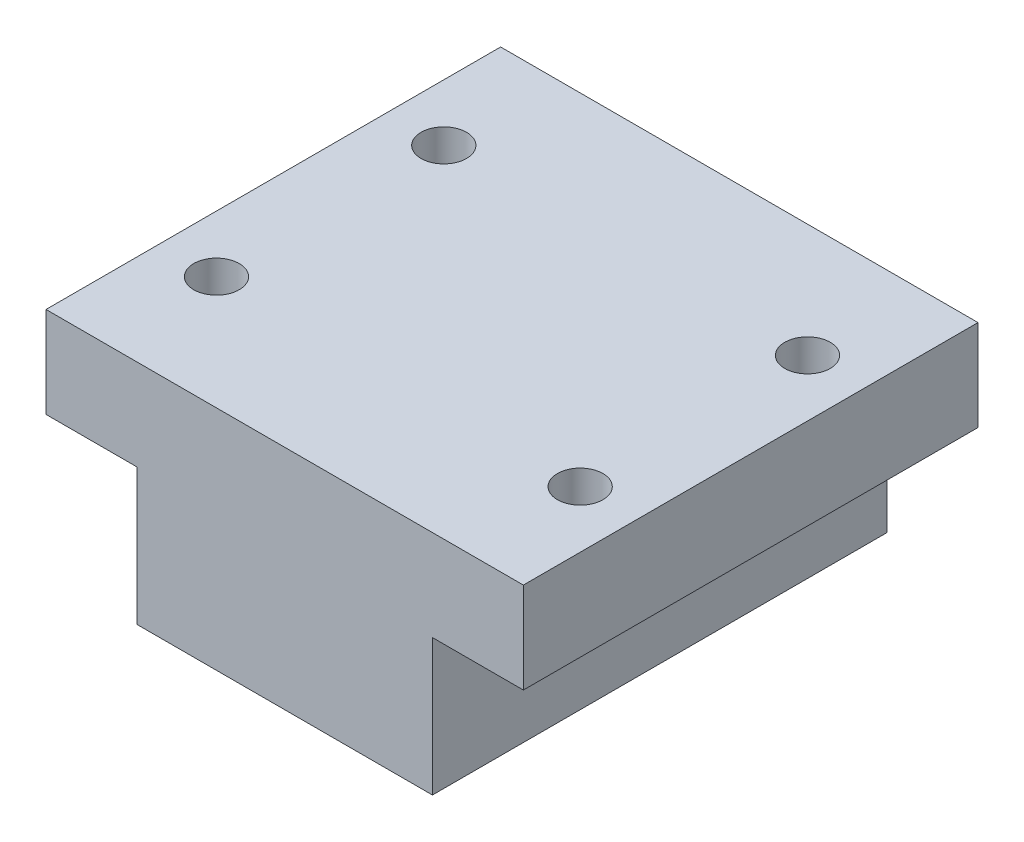
from build123d import *

# Parameters (mm, degrees)
BOSS_EXTRUDE1_DEPTH = 20
SKETCH2_R           = 2
CUT_EXTRUDE1_DEPTH  = 40
SKETCH4_R           = 5.5
CUT_EXTRUDE2_DEPTH  = 1.75


with BuildPart() as part:
    # Sketch1 → Boss-Extrude1 (new, symmetric)
    with BuildSketch(Plane.XY):
        Polygon((13, -4), (21, -4), (21, 4), (-21, 4), (-21, -4), (-13, -4), (-13, -16), (13, -16), align=None)
    extrude(amount=BOSS_EXTRUDE1_DEPTH, both=True)

    # Sketch2 → Cut-Extrude1 (cut)
    with BuildSketch(Plane(origin=(0, 4, 0), x_dir=(1, 0, 0), z_dir=(0, 1, 0))):
        with Locations((-16, 10)):
            Circle(SKETCH2_R)
        with Locations((16, 10)):
            Circle(SKETCH2_R)
        with Locations((-16, -10)):
            Circle(SKETCH2_R)
        with Locations((16, -10)):
            Circle(SKETCH2_R)
    extrude(amount=-CUT_EXTRUDE1_DEPTH, mode=Mode.SUBTRACT)

    # Sketch4 → Cut-Extrude2 (cut)
    with BuildSketch(Plane.XZ.offset(16)):
        with Locations((0, -4.5)):
            Circle(SKETCH4_R)
    extrude(amount=-CUT_EXTRUDE2_DEPTH, mode=Mode.SUBTRACT)


solid = part.part
